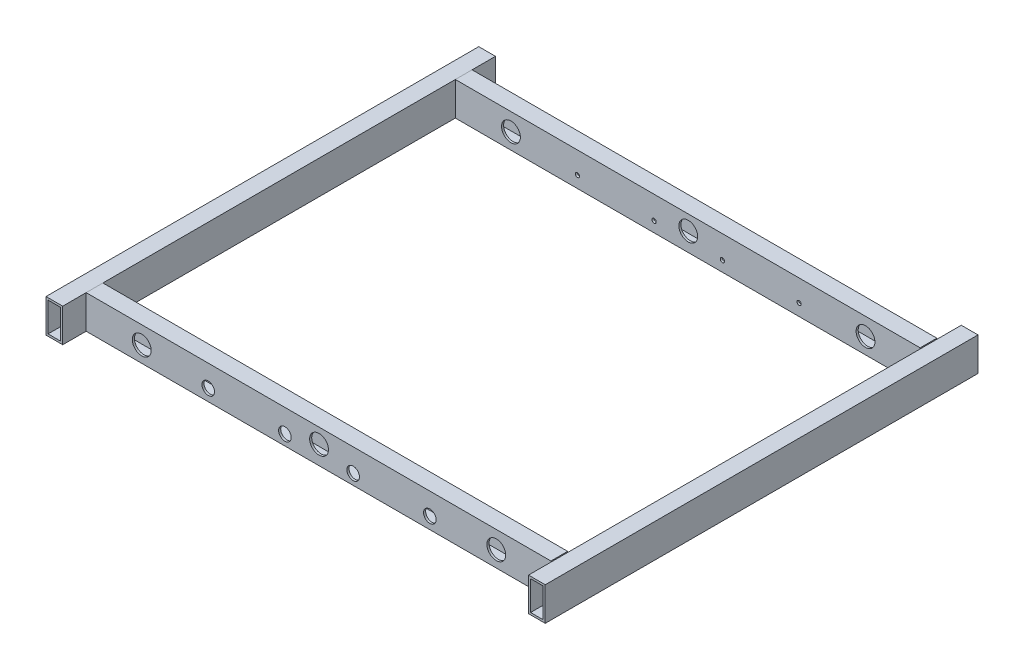
from build123d import *

# Parameters (mm, degrees)
STRUCTURAL_START                       = -25.4
STRUCTURAL_MEMBER1_OUTLINE_W           = 707.39
STRUCTURAL_MEMBER1_OUTLINE_H           = 3.175
STRUCTURAL_MEMBER1_DEPTH               = 50.8
STRUCTURAL_MEMBER1_2_OUTLINE_W         = 707.39
STRUCTURAL_MEMBER1_2_OUTLINE_H         = 19.05
STRUCTURAL_MEMBER1_2_DEPTH             = 3.175
STRUCTURAL_START_2                     = 22.225
STRUCTURAL_MEMBER1_3_OUTLINE_W         = 707.39
STRUCTURAL_MEMBER1_3_OUTLINE_H         = 19.05
STRUCTURAL_MEMBER1_3_DEPTH             = 3.175
STRUCTURAL_MEMBER1_4_OUTLINE_W         = 707.39
STRUCTURAL_MEMBER1_4_OUTLINE_H         = 3.175
STRUCTURAL_MEMBER1_4_DEPTH             = 50.8
STRUCTURAL_MEMBER1_5_OUTLINE_W         = 707.39
STRUCTURAL_MEMBER1_5_OUTLINE_H         = 19.05
STRUCTURAL_MEMBER1_5_DEPTH             = 3.175
STRUCTURAL_MEMBER1_6_OUTLINE_W         = 707.39
STRUCTURAL_MEMBER1_6_OUTLINE_H         = 19.05
STRUCTURAL_MEMBER1_6_DEPTH             = 3.175
STRUCTURAL_START_3                     = -12.7
STRUCTURAL_MEMBER1_7_OUTLINE_W         = 50.8
STRUCTURAL_MEMBER1_7_OUTLINE_H         = 657.225
STRUCTURAL_MEMBER1_7_DEPTH             = 3.175
STRUCTURAL_START_4                     = 9.525
STRUCTURAL_MEMBER1_8_OUTLINE_W         = 50.8
STRUCTURAL_MEMBER1_8_OUTLINE_H         = 657.225
STRUCTURAL_MEMBER1_8_DEPTH             = 3.175
STRUCTURAL_START_5                     = -9.525
STRUCTURAL_MEMBER1_9_OUTLINE_W         = 3.175
STRUCTURAL_MEMBER1_9_OUTLINE_H         = 657.225
STRUCTURAL_MEMBER1_9_DEPTH             = 19.05
STRUCTURAL_START_6                     = 720.09
STRUCTURAL_MEMBER1_10_OUTLINE_W        = 50.8
STRUCTURAL_MEMBER1_10_OUTLINE_H        = 657.225
STRUCTURAL_MEMBER1_10_DEPTH            = 3.175
STRUCTURAL_START_7                     = 742.315
STRUCTURAL_MEMBER1_11_OUTLINE_W        = 50.8
STRUCTURAL_MEMBER1_11_OUTLINE_H        = 657.225
STRUCTURAL_MEMBER1_11_DEPTH            = 3.175
STRUCTURAL_START_8                     = 723.265
STRUCTURAL_MEMBER1_12_OUTLINE_W        = 3.175
STRUCTURAL_MEMBER1_12_OUTLINE_H        = 657.225
STRUCTURAL_MEMBER1_12_DEPTH            = 19.05
SKETCH5_R                              = 14.2875
CUT_EXTRUDE1_DEPTH                     = 932.688
CUT_EXTRUDE8_START                     = -3.175
SKETCH8_R                              = 3.175
CUT_EXTRUDE8_DEPTH                     = 541.655
SKETCH10_R                             = 9.525
CUT_EXTRUDE9_DEPTH                     = 11.176
SKETCH11_R                             = 9.525
CUT_EXTRUDE10_DEPTH                    = 14.986
SKETCH13_W                             = 3.2
SKETCH13_H                             = 3.176
M6_CLEARANCE_HOLE1_AT_2_COUNT          = 2
M6_CLEARANCE_HOLE1_AT_2_PITCH          = 103.664253865
SKETCH17_W                             = 3.2
SKETCH17_H                             = 3.176
M6_CLEARANCE_HOLE3_AT_2_COUNT          = 2
M6_CLEARANCE_HOLE3_AT_2_PITCH          = 103.664253865
SKETCH20_R                             = 9.525
CUT_EXTRUDE11_DEPTH                    = 3.175
SKETCH21_R                             = 9.525
CUT_EXTRUDE12_DEPTH                    = 3.175
SKETCH22_R                             = 9.525
CUT_EXTRUDE13_DEPTH                    = 3.175
SKETCH23_R                             = 9.525
CUT_EXTRUDE14_DEPTH                    = 3.175
F_10_START                             = -25.4
F_10_0_1935_DIAMETER_HOLE1_OUTLINE_R   = 2.45745
F_10_0_1935_DIAMETER_HOLE1_DEPTH       = 3.175
SKETCH26_W                             = 2.45745
SKETCH26_H                             = 3.176
F_10_0_1935_DIAMETER_HOLE2_AT_2_COUNT  = 2
F_10_0_1935_DIAMETER_HOLE2_AT_2_PITCH  = 25.4
F_10_0_1935_DIAMETER_HOLE2_AT_3_COUNT  = 2
F_10_0_1935_DIAMETER_HOLE2_AT_3_PITCH  = 50.8
F_10_0_1935_DIAMETER_HOLE2_AT_4_COUNT  = 2
F_10_0_1935_DIAMETER_HOLE2_AT_4_PITCH  = 56.796126628
F_10_0_1935_DIAMETER_HOLE2_AT_5_COUNT  = 2
F_10_0_1935_DIAMETER_HOLE2_AT_5_PITCH  = 71.842048969
F_10_0_1935_DIAMETER_HOLE2_AT_6_COUNT  = 2
F_10_0_1935_DIAMETER_HOLE2_AT_6_PITCH  = 683.879375402
F_10_0_1935_DIAMETER_HOLE2_AT_7_COUNT  = 2
F_10_0_1935_DIAMETER_HOLE2_AT_7_PITCH  = 709.211711762
F_10_0_1935_DIAMETER_HOLE2_AT_8_COUNT  = 2
F_10_0_1935_DIAMETER_HOLE2_AT_8_PITCH  = 733.230075829
F_10_0_1935_DIAMETER_HOLE2_AT_9_COUNT  = 2
F_10_0_1935_DIAMETER_HOLE2_AT_9_PITCH  = 734.548721393
F_10_0_1935_DIAMETER_HOLE2_AT_10_COUNT = 2
F_10_0_1935_DIAMETER_HOLE2_AT_10_PITCH = 732.79
F_10_0_1935_DIAMETER_HOLE2_AT_11_COUNT = 2
F_10_0_1935_DIAMETER_HOLE2_AT_11_PITCH = 851.535947054
F_10_0_1935_DIAMETER_HOLE2_AT_12_COUNT = 2
F_10_0_1935_DIAMETER_HOLE2_AT_12_PITCH = 872.011307911
F_10_0_1935_DIAMETER_HOLE2_AT_13_COUNT = 2
F_10_0_1935_DIAMETER_HOLE2_AT_13_PITCH = 892.739767864
F_10_0_1935_DIAMETER_HOLE2_AT_14_COUNT = 2
F_10_0_1935_DIAMETER_HOLE2_AT_14_PITCH = 878.479526867
F_10_0_1935_DIAMETER_HOLE2_AT_15_COUNT = 2
F_10_0_1935_DIAMETER_HOLE2_AT_15_PITCH = 864.730353998
SKETCH28_W                             = 25.4
SKETCH28_H                             = 50.8
CUT_EXTRUDE15_DEPTH                    = 1.524


# Read off the part's stored shape, not the designer's step: Structural Member1, #10 (0.1935) Diameter Hole1
with BuildPart() as part:
    # Structural Member1 outline → Structural Member1 (new body)
    with BuildSketch(Plane(origin=(0, 0, 0), x_dir=(1, 0, 0), z_dir=(0, 1, 0)).offset(STRUCTURAL_START)):
        with Locations((366.395, -59.3725)):
            Rectangle(STRUCTURAL_MEMBER1_OUTLINE_W, STRUCTURAL_MEMBER1_OUTLINE_H)
        with Locations((366.395, -37.1475)):
            Rectangle(STRUCTURAL_MEMBER1_OUTLINE_W, STRUCTURAL_MEMBER1_OUTLINE_H)
    extrude(amount=STRUCTURAL_MEMBER1_DEPTH)

    # Structural Member1 2 outline → Structural Member1 2 (add)
    with BuildSketch(Plane(origin=(0, 0, 0), x_dir=(1, 0, 0), z_dir=(0, 1, 0)).offset(STRUCTURAL_START)):
        with Locations((366.395, -48.26)):
            Rectangle(STRUCTURAL_MEMBER1_2_OUTLINE_W, STRUCTURAL_MEMBER1_2_OUTLINE_H)
    extrude(amount=STRUCTURAL_MEMBER1_2_DEPTH)

    # Structural Member1 3 outline → Structural Member1 3 (add)
    with BuildSketch(Plane(origin=(0, 0, 0), x_dir=(1, 0, 0), z_dir=(0, 1, 0)).offset(STRUCTURAL_START_2)):
        with Locations((366.395, -48.26)):
            Rectangle(STRUCTURAL_MEMBER1_3_OUTLINE_W, STRUCTURAL_MEMBER1_3_OUTLINE_H)
    extrude(amount=STRUCTURAL_MEMBER1_3_DEPTH)


with BuildPart() as body_2:
    # Structural Member1 4 outline → Structural Member1 4 (new body)
    with BuildSketch(Plane(origin=(0, 0, 0), x_dir=(1, 0, 0), z_dir=(0, 1, 0)).offset(STRUCTURAL_START)):
        with Locations((366.395, -620.0775)):
            Rectangle(STRUCTURAL_MEMBER1_4_OUTLINE_W, STRUCTURAL_MEMBER1_4_OUTLINE_H)
        with Locations((366.395, -597.8525)):
            Rectangle(STRUCTURAL_MEMBER1_4_OUTLINE_W, STRUCTURAL_MEMBER1_4_OUTLINE_H)
    extrude(amount=STRUCTURAL_MEMBER1_4_DEPTH)

    # Structural Member1 5 outline → Structural Member1 5 (add)
    with BuildSketch(Plane(origin=(0, 0, 0), x_dir=(1, 0, 0), z_dir=(0, 1, 0)).offset(STRUCTURAL_START)):
        with Locations((366.395, -608.965)):
            Rectangle(STRUCTURAL_MEMBER1_5_OUTLINE_W, STRUCTURAL_MEMBER1_5_OUTLINE_H)
    extrude(amount=STRUCTURAL_MEMBER1_5_DEPTH)

    # Structural Member1 6 outline → Structural Member1 6 (add)
    with BuildSketch(Plane(origin=(0, 0, 0), x_dir=(1, 0, 0), z_dir=(0, 1, 0)).offset(STRUCTURAL_START_2)):
        with Locations((366.395, -608.965)):
            Rectangle(STRUCTURAL_MEMBER1_6_OUTLINE_W, STRUCTURAL_MEMBER1_6_OUTLINE_H)
    extrude(amount=STRUCTURAL_MEMBER1_6_DEPTH)


with BuildPart() as body_3:
    # Structural Member1 7 outline → Structural Member1 7 (new body)
    with BuildSketch(Plane.YZ.offset(STRUCTURAL_START_3)):
        with Locations((0, 328.6125)):
            Rectangle(STRUCTURAL_MEMBER1_7_OUTLINE_W, STRUCTURAL_MEMBER1_7_OUTLINE_H)
    extrude(amount=STRUCTURAL_MEMBER1_7_DEPTH)

    # Structural Member1 8 outline → Structural Member1 8 (add)
    with BuildSketch(Plane.YZ.offset(STRUCTURAL_START_4)):
        with Locations((0, 328.6125)):
            Rectangle(STRUCTURAL_MEMBER1_8_OUTLINE_W, STRUCTURAL_MEMBER1_8_OUTLINE_H)
    extrude(amount=STRUCTURAL_MEMBER1_8_DEPTH)

    # Structural Member1 9 outline → Structural Member1 9 (add)
    with BuildSketch(Plane.YZ.offset(STRUCTURAL_START_5)):
        with Locations((-23.8125, 328.6125)):
            Rectangle(STRUCTURAL_MEMBER1_9_OUTLINE_W, STRUCTURAL_MEMBER1_9_OUTLINE_H)
        with Locations((23.8125, 328.6125)):
            Rectangle(STRUCTURAL_MEMBER1_9_OUTLINE_W, STRUCTURAL_MEMBER1_9_OUTLINE_H)
    extrude(amount=STRUCTURAL_MEMBER1_9_DEPTH)


with BuildPart() as body_4:
    # Structural Member1 10 outline → Structural Member1 10 (new body)
    with BuildSketch(Plane.YZ.offset(STRUCTURAL_START_6)):
        with Locations((0, 328.6125)):
            Rectangle(STRUCTURAL_MEMBER1_10_OUTLINE_W, STRUCTURAL_MEMBER1_10_OUTLINE_H)
    extrude(amount=STRUCTURAL_MEMBER1_10_DEPTH)

    # Structural Member1 11 outline → Structural Member1 11 (add)
    with BuildSketch(Plane.YZ.offset(STRUCTURAL_START_7)):
        with Locations((0, 328.6125)):
            Rectangle(STRUCTURAL_MEMBER1_11_OUTLINE_W, STRUCTURAL_MEMBER1_11_OUTLINE_H)
    extrude(amount=STRUCTURAL_MEMBER1_11_DEPTH)

    # Structural Member1 12 outline → Structural Member1 12 (add)
    with BuildSketch(Plane.YZ.offset(STRUCTURAL_START_8)):
        with Locations((-23.8125, 328.6125)):
            Rectangle(STRUCTURAL_MEMBER1_12_OUTLINE_W, STRUCTURAL_MEMBER1_12_OUTLINE_H)
        with Locations((23.8125, 328.6125)):
            Rectangle(STRUCTURAL_MEMBER1_12_OUTLINE_W, STRUCTURAL_MEMBER1_12_OUTLINE_H)
    extrude(amount=STRUCTURAL_MEMBER1_12_DEPTH)


with BuildPart() as cut_extrude1_tool:
    # Sketch5 → Cut-Extrude1 (new body)
    with BuildSketch(Plane.XY.offset(621.665)):
        with Locations(Location((366.395, 2.794, 0), (0, 0, 180))):
            Circle(SKETCH5_R)
        with Locations(Location((97.155, -1.27, 0), (0, 0, 180))):
            Circle(SKETCH5_R)
        with Locations(Location((635.635, -1.27, 0), (0, 0, 180))):
            Circle(SKETCH5_R)
    extrude(amount=-CUT_EXTRUDE1_DEPTH)


with BuildPart() as part_1:
    add(part.part)

    # Cut-Extrude1: cut by cut_extrude1_tool
    add(cut_extrude1_tool.part, mode=Mode.SUBTRACT)


with BuildPart() as body_2_1:
    add(body_2.part)

    # Cut-Extrude1: cut by cut_extrude1_tool
    add(cut_extrude1_tool.part, mode=Mode.SUBTRACT)


with BuildPart() as cut_extrude8_tool:
    # Sketch8 → Cut-Extrude8 (new body)
    with BuildSketch(Plane.XY.offset(60.96).offset(CUT_EXTRUDE8_START)):
        with Locations(Location((534.67, -7.62, 0), (0, 0, 180))):
            Circle(SKETCH8_R)
        with Locations(Location((198.12, -7.62, 0), (0, 0, 180))):
            Circle(SKETCH8_R)
    extrude(amount=CUT_EXTRUDE8_DEPTH)


with BuildPart() as part_2:
    add(part_1.part)

    # Cut-Extrude8: cut by cut_extrude8_tool
    add(cut_extrude8_tool.part, mode=Mode.SUBTRACT)

    # Sketch11 → Cut-Extrude10 (cut)
    with BuildSketch(Plane(origin=(0, 0, 35.56), x_dir=(-1, 0, 0), z_dir=(0, 0, -1))):
        with Locations((-198.12, -7.62)):
            Circle(SKETCH11_R)
        with Locations((-534.67, -7.62)):
            Circle(SKETCH11_R)
    extrude(amount=-CUT_EXTRUDE10_DEPTH, mode=Mode.SUBTRACT)

    # Sketch13 → M6 Clearance Hole1 (revolve, cut)
    with BuildSketch(Plane(origin=(314.562873067, -9.525, 60.96), x_dir=(0, -1, 0), z_dir=(1, 0, 0))):
        with Locations((1.6, 1.588)):
            Rectangle(SKETCH13_W, SKETCH13_H)
    m6_clearance_hole1 = revolve(axis=Axis((314.562873067, -9.525, 67.31), (0, 0, -1)), mode=Mode.SUBTRACT)

    # M6 Clearance Hole1 at 2: M6 Clearance Hole1 ×2
    with Locations(*[(i * M6_CLEARANCE_HOLE1_AT_2_PITCH, 0, 0) for i in range(1, M6_CLEARANCE_HOLE1_AT_2_COUNT)]):
        add(m6_clearance_hole1, mode=Mode.SUBTRACT)

    # Sketch22 → Cut-Extrude13 (cut)
    with BuildSketch(Plane(origin=(0, 0, 35.56), x_dir=(-1, 0, 0), z_dir=(0, 0, -1))):
        with Locations((-418.227126933, -9.525)):
            Circle(SKETCH22_R)
    extrude(amount=-CUT_EXTRUDE13_DEPTH, mode=Mode.SUBTRACT)

    # Sketch23 → Cut-Extrude14 (cut)
    with BuildSketch(Plane(origin=(0, 0, 35.56), x_dir=(-1, 0, 0), z_dir=(0, 0, -1))):
        with Locations((-314.562873067, -9.525)):
            Circle(SKETCH23_R)
    extrude(amount=-CUT_EXTRUDE14_DEPTH, mode=Mode.SUBTRACT)


with BuildPart() as body_2_2:
    add(body_2_1.part)

    # Cut-Extrude8: cut by cut_extrude8_tool
    add(cut_extrude8_tool.part, mode=Mode.SUBTRACT)

    # Sketch10 → Cut-Extrude9 (cut)
    with BuildSketch(Plane.XY.offset(621.665)):
        with Locations((534.67, -7.62)):
            Circle(SKETCH10_R)
        with Locations((198.12, -7.62)):
            Circle(SKETCH10_R)
    extrude(amount=-CUT_EXTRUDE9_DEPTH, mode=Mode.SUBTRACT)

    # Sketch17 → M6 Clearance Hole3 (revolve, cut)
    with BuildSketch(Plane(origin=(418.227126933, -9.525, 596.265), x_dir=(0, 1, 0), z_dir=(1, 0, 0))):
        with Locations((1.6, 1.588)):
            Rectangle(SKETCH17_W, SKETCH17_H)
    m6_clearance_hole3 = revolve(axis=Axis((418.227126933, -9.525, 589.915), (0, 0, 1)), mode=Mode.SUBTRACT)

    # M6 Clearance Hole3 at 2: M6 Clearance Hole3 ×2
    with Locations(*[(-i * M6_CLEARANCE_HOLE3_AT_2_PITCH, 0, 0) for i in range(1, M6_CLEARANCE_HOLE3_AT_2_COUNT)]):
        add(m6_clearance_hole3, mode=Mode.SUBTRACT)

    # Sketch20 → Cut-Extrude11 (cut)
    with BuildSketch(Plane.XY.offset(621.665)):
        with Locations((314.562873067, -9.525)):
            Circle(SKETCH20_R)
    extrude(amount=-CUT_EXTRUDE11_DEPTH, mode=Mode.SUBTRACT)

    # Sketch21 → Cut-Extrude12 (cut)
    with BuildSketch(Plane.XY.offset(621.665)):
        with Locations((418.227126933, -9.525)):
            Circle(SKETCH21_R)
    extrude(amount=-CUT_EXTRUDE12_DEPTH, mode=Mode.SUBTRACT)


with BuildPart() as f_10_0_1935_diameter_hole1_tool:
    # #10 (0.1935) Diameter Hole1 outline → #10 (0.1935) Diameter Hole1 (new body)
    with BuildSketch(Plane(origin=(0, 0, 0), x_dir=(1, 0, 0), z_dir=(0, 1, 0)).offset(F_10_START)):
        with Locations((681.99, -48.26)):
            Circle(F_10_0_1935_DIAMETER_HOLE1_OUTLINE_R)
        with Locations((707.39, -48.26)):
            Circle(F_10_0_1935_DIAMETER_HOLE1_OUTLINE_R)
        with Locations((732.79, -48.26)):
            Circle(F_10_0_1935_DIAMETER_HOLE1_OUTLINE_R)
        with Locations((732.79, -73.66)):
            Circle(F_10_0_1935_DIAMETER_HOLE1_OUTLINE_R)
        with Locations((732.79, -99.06)):
            Circle(F_10_0_1935_DIAMETER_HOLE1_OUTLINE_R)
    extrude(amount=F_10_0_1935_DIAMETER_HOLE1_DEPTH)


with BuildPart() as part_3:
    add(part_2.part)

    # #10 (0.1935) Diameter Hole1: cut by f_10_0_1935_diameter_hole1_tool
    add(f_10_0_1935_diameter_hole1_tool.part, mode=Mode.SUBTRACT)


with BuildPart() as body_4_1:
    add(body_4.part)

    # #10 (0.1935) Diameter Hole1: cut by f_10_0_1935_diameter_hole1_tool
    add(f_10_0_1935_diameter_hole1_tool.part, mode=Mode.SUBTRACT)

    # Sketch26 → #10 (0.1935) Diameter Hole2 (revolve, cut)
    with BuildSketch(Plane(origin=(732.79, -25.4, 558.165), x_dir=(0, 0, -1), z_dir=(1, 0, 0))):
        with Locations((1.228725, 1.588)):
            Rectangle(SKETCH26_W, SKETCH26_H)
    f_10_0_1935_diameter_hole2 = revolve(axis=Axis((732.79, -31.75, 558.165), (0, 1, 0)), mode=Mode.SUBTRACT)

    # #10 (0.1935) Diameter Hole2 at 2: #10 (0.1935) Diameter Hole2 ×2
    with Locations(*[(0, 0, i * F_10_0_1935_DIAMETER_HOLE2_AT_2_PITCH) for i in range(1, F_10_0_1935_DIAMETER_HOLE2_AT_2_COUNT)]):
        add(f_10_0_1935_diameter_hole2, mode=Mode.SUBTRACT)

    # #10 (0.1935) Diameter Hole2 at 3: #10 (0.1935) Diameter Hole2 ×2
    with Locations(*[(0, 0, i * F_10_0_1935_DIAMETER_HOLE2_AT_3_PITCH) for i in range(1, F_10_0_1935_DIAMETER_HOLE2_AT_3_COUNT)]):
        add(f_10_0_1935_diameter_hole2, mode=Mode.SUBTRACT)


with BuildPart() as body_2_3:
    add(body_2_2.part)

    # #10 (0.1935) Diameter Hole2 at 4: #10 (0.1935) Diameter Hole2 ×2
    with Locations(*[Vector(-0.447213595499958, 0, 0.894427190999916) * (i * F_10_0_1935_DIAMETER_HOLE2_AT_4_PITCH) for i in range(1, F_10_0_1935_DIAMETER_HOLE2_AT_4_COUNT)]):
        add(f_10_0_1935_diameter_hole2, mode=Mode.SUBTRACT)

    # #10 (0.1935) Diameter Hole2 at 5: #10 (0.1935) Diameter Hole2 ×2
    with Locations(*[Vector(-0.7071067811865476, 0, 0.7071067811865476) * (i * F_10_0_1935_DIAMETER_HOLE2_AT_5_PITCH) for i in range(1, F_10_0_1935_DIAMETER_HOLE2_AT_5_COUNT)]):
        add(f_10_0_1935_diameter_hole2, mode=Mode.SUBTRACT)

    # #10 (0.1935) Diameter Hole2 at 6: #10 (0.1935) Diameter Hole2 ×2
    with Locations(*[Vector(-0.9972372680478602, 0, 0.07428210562740108) * (i * F_10_0_1935_DIAMETER_HOLE2_AT_6_PITCH) for i in range(1, F_10_0_1935_DIAMETER_HOLE2_AT_6_COUNT)]):
        add(f_10_0_1935_diameter_hole2, mode=Mode.SUBTRACT)

    # #10 (0.1935) Diameter Hole2 at 7: #10 (0.1935) Diameter Hole2 ×2
    with Locations(*[Vector(-0.9974313569114609, 0, 0.07162882275845313) * (i * F_10_0_1935_DIAMETER_HOLE2_AT_7_PITCH) for i in range(1, F_10_0_1935_DIAMETER_HOLE2_AT_7_COUNT)]):
        add(f_10_0_1935_diameter_hole2, mode=Mode.SUBTRACT)


with BuildPart() as body_3_1:
    add(body_3.part)

    # #10 (0.1935) Diameter Hole2 at 8: #10 (0.1935) Diameter Hole2 ×2
    with Locations(*[Vector(-0.9993998120871332, 0, 0.034641241320177894) * (i * F_10_0_1935_DIAMETER_HOLE2_AT_8_PITCH) for i in range(1, F_10_0_1935_DIAMETER_HOLE2_AT_8_COUNT)]):
        add(f_10_0_1935_diameter_hole2, mode=Mode.SUBTRACT)

    # #10 (0.1935) Diameter Hole2 at 9: #10 (0.1935) Diameter Hole2 ×2
    with Locations(*[Vector(-0.9976057117224263, 0, 0.06915810826498615) * (i * F_10_0_1935_DIAMETER_HOLE2_AT_9_PITCH) for i in range(1, F_10_0_1935_DIAMETER_HOLE2_AT_9_COUNT)]):
        add(f_10_0_1935_diameter_hole2, mode=Mode.SUBTRACT)

    # #10 (0.1935) Diameter Hole2 at 10: #10 (0.1935) Diameter Hole2 ×2
    with Locations(*[(-i * F_10_0_1935_DIAMETER_HOLE2_AT_10_PITCH, 0, 0) for i in range(1, F_10_0_1935_DIAMETER_HOLE2_AT_10_COUNT)]):
        add(f_10_0_1935_diameter_hole2, mode=Mode.SUBTRACT)

    # #10 (0.1935) Diameter Hole2 at 13: #10 (0.1935) Diameter Hole2 ×2
    with Locations(*[Vector(-0.8208327066617611, 0, -0.5711686858313639) * (i * F_10_0_1935_DIAMETER_HOLE2_AT_13_PITCH) for i in range(1, F_10_0_1935_DIAMETER_HOLE2_AT_13_COUNT)]):
        add(f_10_0_1935_diameter_hole2, mode=Mode.SUBTRACT)

    # #10 (0.1935) Diameter Hole2 at 14: #10 (0.1935) Diameter Hole2 ×2
    with Locations(*[Vector(-0.8341571745139719, 0, -0.5515267973606243) * (i * F_10_0_1935_DIAMETER_HOLE2_AT_14_PITCH) for i in range(1, F_10_0_1935_DIAMETER_HOLE2_AT_14_COUNT)]):
        add(f_10_0_1935_diameter_hole2, mode=Mode.SUBTRACT)

    # #10 (0.1935) Diameter Hole2 at 15: #10 (0.1935) Diameter Hole2 ×2
    with Locations(*[Vector(-0.8474202352354836, 0, -0.5309227297012604) * (i * F_10_0_1935_DIAMETER_HOLE2_AT_15_PITCH) for i in range(1, F_10_0_1935_DIAMETER_HOLE2_AT_15_COUNT)]):
        add(f_10_0_1935_diameter_hole2, mode=Mode.SUBTRACT)


with BuildPart() as part_4:
    add(part_3.part)

    # #10 (0.1935) Diameter Hole2 at 11: #10 (0.1935) Diameter Hole2 ×2
    with Locations(*[Vector(-0.8008939638537933, 0, -0.5988061945759738) * (i * F_10_0_1935_DIAMETER_HOLE2_AT_11_PITCH) for i in range(1, F_10_0_1935_DIAMETER_HOLE2_AT_11_COUNT)]):
        add(f_10_0_1935_diameter_hole2, mode=Mode.SUBTRACT)

    # #10 (0.1935) Diameter Hole2 at 12: #10 (0.1935) Diameter Hole2 ×2
    with Locations(*[Vector(-0.8112165445359533, 0, -0.584745857506616) * (i * F_10_0_1935_DIAMETER_HOLE2_AT_12_PITCH) for i in range(1, F_10_0_1935_DIAMETER_HOLE2_AT_12_COUNT)]):
        add(f_10_0_1935_diameter_hole2, mode=Mode.SUBTRACT)


with BuildPart() as cut_extrude15_tool:
    # Sketch28 → Cut-Extrude15 (new body)
    with BuildSketch(Plane(origin=(720.09, 0, 0), x_dir=(0, 0, -1), z_dir=(1, 0, 0))):
        with Locations((-48.26, 0)):
            Rectangle(SKETCH28_W, SKETCH28_H)
        with Locations((-608.965, 0)):
            Rectangle(SKETCH28_W, SKETCH28_H)
    extrude(amount=-CUT_EXTRUDE15_DEPTH)


with BuildPart() as part_5:
    add(part_4.part)

    # Cut-Extrude15: cut by cut_extrude15_tool
    add(cut_extrude15_tool.part, mode=Mode.SUBTRACT)


with BuildPart() as body_2_4:
    add(body_2_3.part)

    # Cut-Extrude15: cut by cut_extrude15_tool
    add(cut_extrude15_tool.part, mode=Mode.SUBTRACT)


solid = Compound([body_4_1.part, body_3_1.part, part_5.part, body_2_4.part])
